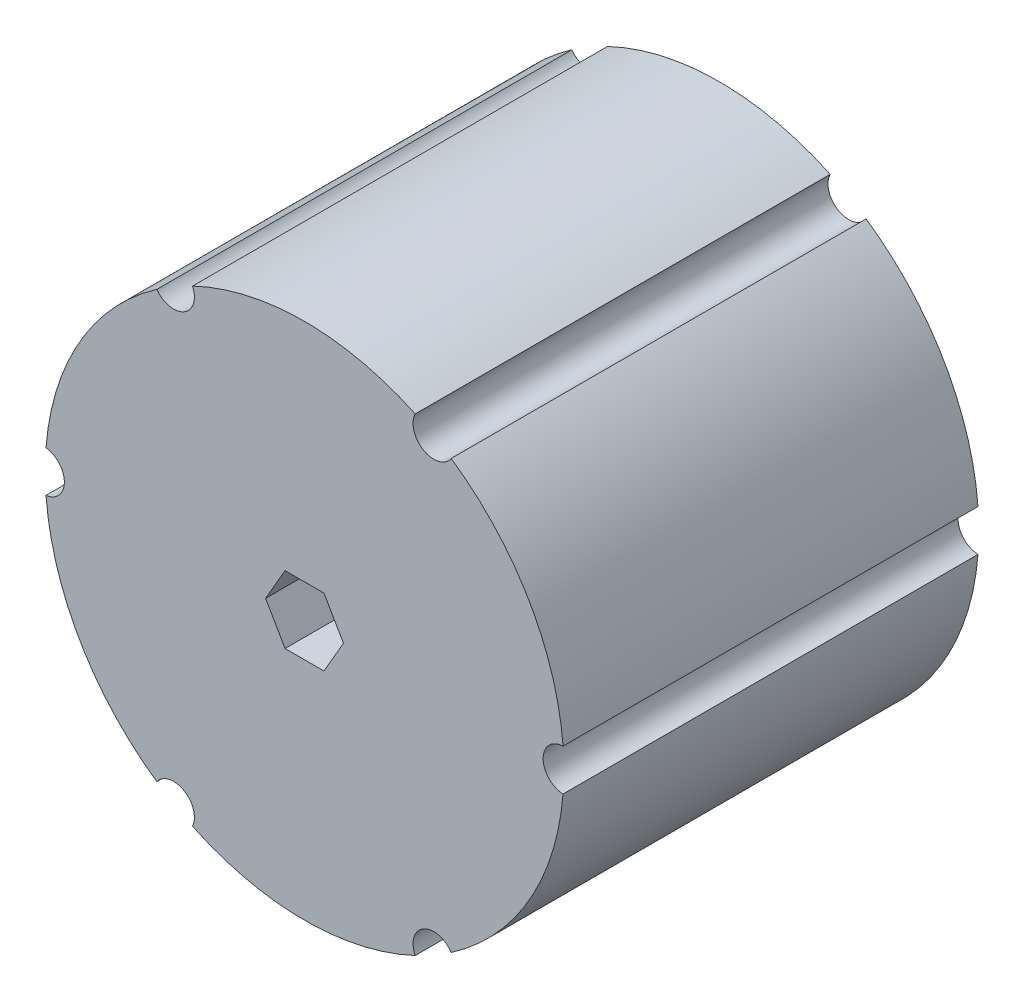
from build123d import *

# Parameters (mm, degrees)
SKETCH1_R           = 25
BOSS_EXTRUDE1_DEPTH = 40
CUT_EXTRUDE1_DEPTH  = 54.38539126
CIRPATTERN1_START   = -40
CIRPATTERN1_DEPTH   = 40
CUT_EXTRUDE2_DEPTH  = 10
SKETCH4_R           = 2.05
CUT_EXTRUDE3_DEPTH  = 10


# Read off the part's stored shape, not the designer's step: CirPattern1
with BuildPart() as part:
    # Sketch1 → Boss-Extrude1 (new body)
    with BuildSketch(Plane.XY):
        Circle(SKETCH1_R)
    extrude(amount=-BOSS_EXTRUDE1_DEPTH)

    # Sketch2 → Cut-Extrude1 (cut, through all)
    with BuildSketch(Plane.XY):
        with BuildLine():
            Line((148.327454228, 6.938651312), (24.92, 1.998399359))
            ThreePointArc((24.92, 1.998399359), (23, 0), (24.92, -1.998399359))
            Line((24.92, -1.998399359), (148.327454228, -6.938651312))
            Line((148.327454228, -6.938651312), (395.340051868, -6.938651312))
            Line((395.340051868, -6.938651312), (395.340051868, 6.938651312))
            Line((395.340051868, 6.938651312), (148.327454228, 6.938651312))
        make_face()
    extrude(amount=-CUT_EXTRUDE1_DEPTH, mode=Mode.SUBTRACT)

    # CirPattern1 outline → CirPattern1 (cut)
    with BuildSketch(Plane.XY.offset(CIRPATTERN1_START)):
        with BuildLine():
            ThreePointArc((14.134833251, -20.620535613), (11.466483325, -19.981917804), (10.671520375, -22.607933406))
            ThreePointArc((10.671520375, -22.607933406), (12.442918972, -21.683490666), (14.134833251, -20.620535613))
        make_face()
        with BuildLine():
            ThreePointArc((-10.795666007, -22.548915616), (-11.609703747, -19.987178691), (-14.238240755, -20.549270065))
            ThreePointArc((-14.238240755, -20.549270065), (-12.556821553, -21.617729586), (-10.795666007, -22.548915616))
        make_face()
        with BuildLine():
            ThreePointArc((-24.920945806, -1.986569943), (-23.152332628, 0), (-24.920945806, 1.986569943))
            ThreePointArc((-24.920945806, 1.986569943), (-25, 0), (-24.920945806, -1.986569943))
        make_face()
        with BuildLine():
            ThreePointArc((-14.238240755, 20.549270065), (-11.609703747, 19.987178691), (-10.795666007, 22.548915616))
            ThreePointArc((-10.795666007, 22.548915616), (-12.556821553, 21.617729586), (-14.238240755, 20.549270065))
        make_face()
        with BuildLine():
            ThreePointArc((10.671520375, 22.607933406), (11.466483325, 19.981917804), (14.134833251, 20.620535613))
            ThreePointArc((14.134833251, 20.620535613), (12.442918972, 21.683490666), (10.671520375, 22.607933406))
        make_face()
    extrude(amount=CIRPATTERN1_DEPTH, mode=Mode.SUBTRACT)

    # Sketch3 → Cut-Extrude2 (cut)
    with BuildSketch(Plane.XY):
        Polygon((3.75277675, 0), (1.876388375, 3.25), (-1.876388375, 3.25), (-3.75277675, 0), (-1.876388375, -3.25), (1.876388375, -3.25), align=None)
    extrude(amount=-CUT_EXTRUDE2_DEPTH, mode=Mode.SUBTRACT)

    # Sketch4 → Cut-Extrude3 (cut)
    with BuildSketch(Plane(origin=(0, 0, -40), x_dir=(-1, 0, 0), z_dir=(0, 0, -1))):
        Circle(SKETCH4_R)
    extrude(amount=-CUT_EXTRUDE3_DEPTH, mode=Mode.SUBTRACT)


solid = part.part
